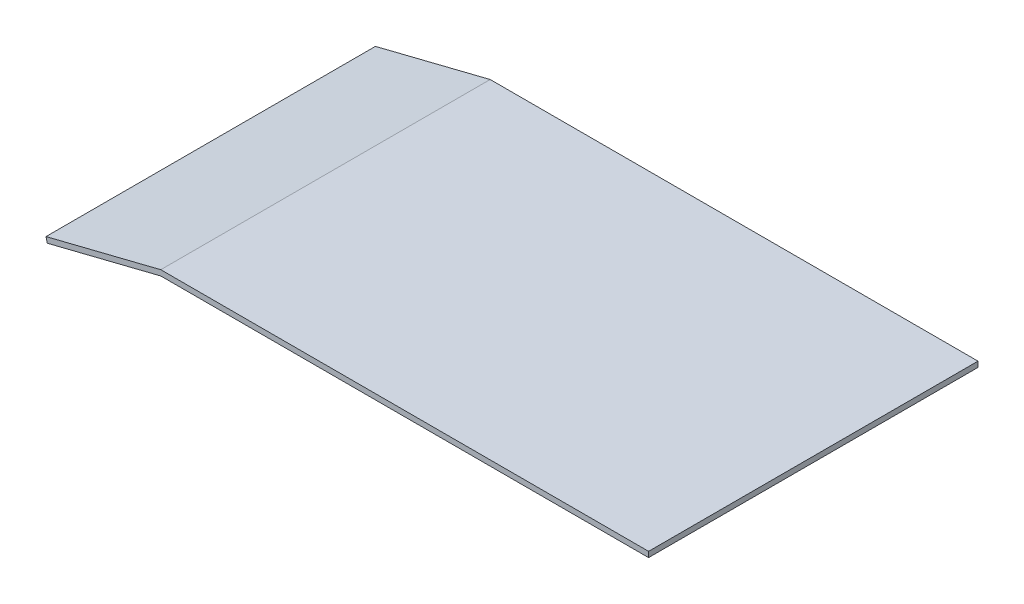
from build123d import *

# Parameters (mm, degrees)
BOSS_EXTRUDE1_DEPTH = 287


with BuildPart() as part:
    # Sketch1 → Boss-Extrude1 (new body)
    with BuildSketch(Plane.XY):
        Polygon((-461.865031966, 4.441681686), (-36.865031966, 4.441681686), (-36.865031966, -0.320818314), (-461.865031966, -0.320818314), (-560.744443731, -25.040671255), (-561.865031966, -20.558318314), align=None)
    extrude(amount=BOSS_EXTRUDE1_DEPTH)


solid = part.part
